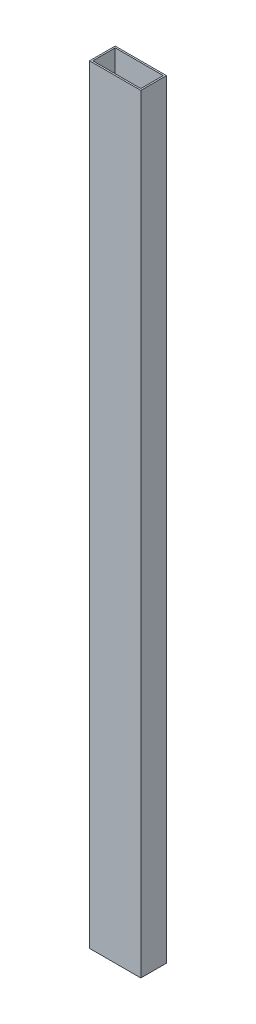
from build123d import *

# Parameters (mm, degrees)
SKETCH1_W           = 50.8
SKETCH1_H           = 25.4
SKETCH1_W_2         = 47.6504
SKETCH1_H_2         = 22.2504
BOSS_EXTRUDE1_DEPTH = 762


with BuildPart() as part:
    # Sketch1 → Boss-Extrude1 (new body)
    with BuildSketch(Plane(origin=(0, 0, 0), x_dir=(1, 0, 0), z_dir=(0, 1, 0))):
        Rectangle(SKETCH1_W, SKETCH1_H)
        Rectangle(SKETCH1_W_2, SKETCH1_H_2, mode=Mode.SUBTRACT)
    extrude(amount=BOSS_EXTRUDE1_DEPTH)


solid = part.part
